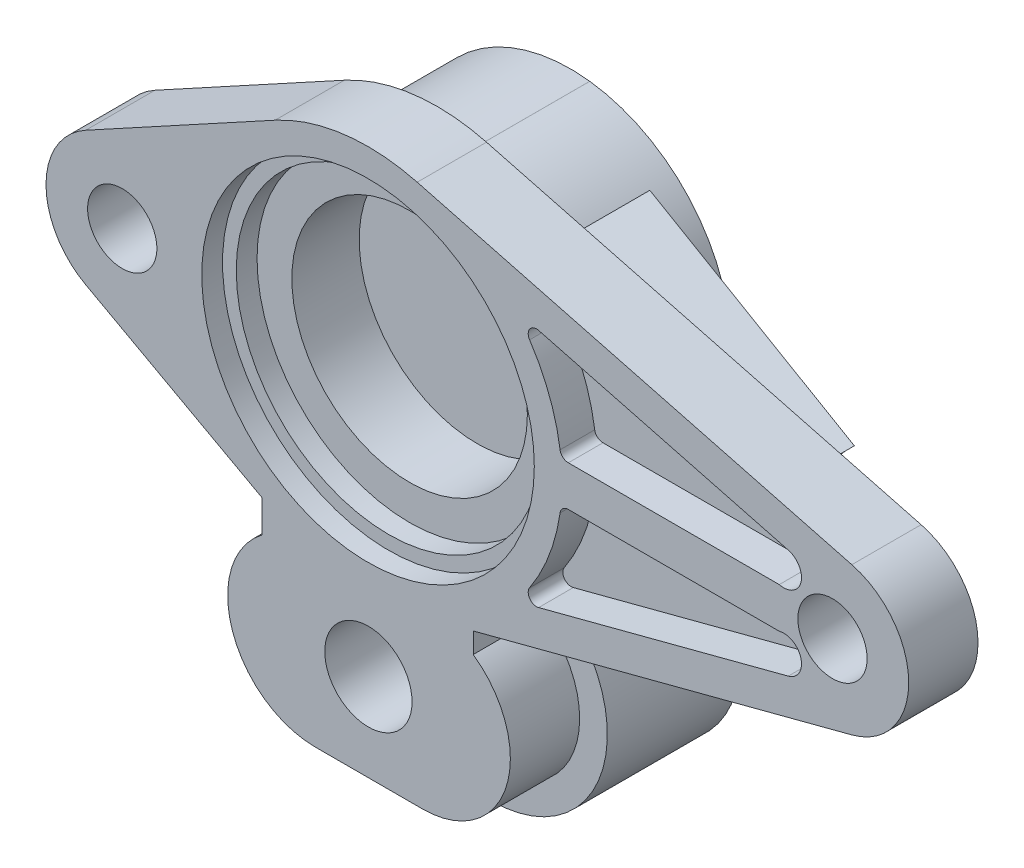
from build123d import *

# Parameters (mm, degrees)
BOSS_EXTRUDE1_DEPTH      = 6.35
BOSS_EXTRUDE2_DEPTH      = 12.192
BOSS_EXTRUDE3_REACH      = 63.797
CUT_EXTRUDE1_DEPTH       = 3.175
CUT_EXTRUDE2_DEPTH       = 3.175
F_8_0_8_DIAMETER_HOLE1_D = 8
HOLE1_D                  = 6.35
CHAMFER1_SIZE            = 3.256138018
CHAMFER2_SIZE            = 2.651435284
FILLET1_R                = 0.762
FILLET2_R                = 17.78


with BuildPart() as part:
    # Sketch1 → Boss-Extrude1 (new body)
    with BuildSketch(Plane.XY):
        with BuildLine():
            Line((-25.876615107, -6.130991244), (-6.855570788, -16.51429077))
            ThreePointArc((-6.855570788, -16.51429077), (-12.797339629, -25.300522195), (-4.835774214, -32.308799856))
            Line((-4.835774214, -32.308799856), (5.019425786, -32.308799856))
            ThreePointArc((5.019425786, -32.308799856), (12.97831912, -25.32120391), (7.079560008, -16.524890981))
            Line((7.079560008, -16.524890981), (44.341655967, -6.756691298))
            ThreePointArc((44.341655967, -6.756691298), (49.5554, 0), (44.341655967, 6.756691298))
            Line((44.341655967, 6.756691298), (-2.321508902, 18.989366367))
            Line((-2.321508902, 18.989366367), (-25.876615107, 6.130991244))
            ThreePointArc((-25.876615107, 6.130991244), (-29.5148, 0), (-25.876615107, -6.130991244))
        make_face()
    extrude(amount=-BOSS_EXTRUDE1_DEPTH)

    # Sketch2 → Boss-Extrude2 (add)
    with BuildSketch(Plane(origin=(0, 0, -6.35), x_dir=(-1, 0, 0), z_dir=(0, 0, -1))):
        with BuildLine():
            Line((4.835774214, -34.848799856), (-5.019425786, -34.848799856))
            ThreePointArc((-5.019425786, -34.848799856), (-14.222989868, -29.47308547), (-14.061825786, -18.815791108))
            Line((-14.061825786, -18.815791108), (-14.061825783, -4.219323287))
            ThreePointArc((-14.061825783, -4.219323287), (-12.289675842, 8.031282652), (-1.781242501, 14.572741966))
            Line((-1.781242501, 14.572741966), (-1.778349168, 14.573095333))
            ThreePointArc((-1.778349168, 14.573095333), (11.415932367, 9.231149524), (13.878174214, -4.788936617))
            Line((13.878174214, -4.788936617), (13.878174214, -18.815791108))
            ThreePointArc((13.878174214, -18.815791108), (14.039338296, -29.47308547), (4.835774214, -34.848799856))
        make_face()
    extrude(amount=BOSS_EXTRUDE2_DEPTH)

    # Boss-Extrude3: up to this plane
    boss_extrude3_end = Plane(origin=(5.084615624, 0, -17.49223415), z_dir=(0.2791253467698281, 0, -0.9602546749642114))
    # Sketch4 → Boss-Extrude3 (add, up to the surface)
    with BuildSketch(Plane(origin=(0, 0, -6.35), x_dir=(-1, 0, 0), z_dir=(0, 0, -1)), mode=Mode.PRIVATE) as boss_extrude3_sk1:
        with BuildLine():
            Line((-36.092721498, 7.827214142), (-9.663817118, 11.052070939))
            ThreePointArc((-9.663817118, 11.052070939), (-14.107813549, 4.062909083), (-14.061825786, -4.219323276))
            Line((-14.061825786, -4.219323276), (-14.061825786, -10.512648454))
            Line((-14.061825786, -10.512648454), (-36.084688558, -7.820559257))
            ThreePointArc((-36.084688558, -7.820559257), (-32.410401339, 0.005215736), (-36.092721498, 7.827214142))
        make_face()
    boss_extrude3_tool1 = split(extrude(boss_extrude3_sk1.sketch, amount=BOSS_EXTRUDE3_REACH, mode=Mode.PRIVATE), bisect_by=boss_extrude3_end, keep=Keep.BOTH, mode=Mode.PRIVATE)
    add(boss_extrude3_tool1.solids().sort_by_distance((23.208362, 0.258221, -6.35))[0])

    # Sketch5 → Cut-Extrude1 (cut)
    with BuildSketch(Plane.XY):
        with BuildLine():
            Line((17.683274588, 1.852079867), (37.689391665, 1.852079867))
            ThreePointArc((37.689391665, 1.852079867), (39.677118992, 3.014104647), (38.515094212, 5.001831974))
            Line((38.515094212, 5.001831974), (15.636334606, 10.999462718))
            ThreePointArc((15.636334606, 10.999462718), (14.82307645, 10.705321164), (14.808458463, 9.840627925))
            ThreePointArc((14.808458463, 9.840627925), (16.729686315, 6.020464751), (17.683274588, 1.852079867))
        make_face()
    extrude(amount=-CUT_EXTRUDE1_DEPTH, mode=Mode.SUBTRACT)

    # Sketch6 → Cut-Extrude2 (cut)
    with BuildSketch(Plane.XY):
        with BuildLine():
            Line((15.636334606, -10.999462718), (38.515094212, -5.001831974))
            ThreePointArc((38.515094212, -5.001831974), (39.677118992, -3.014104647), (37.689391665, -1.852079867))
            Line((37.689391665, -1.852079867), (17.683274588, -1.852079867))
            ThreePointArc((17.683274588, -1.852079867), (16.729686315, -6.020464751), (14.808458463, -9.840627925))
            ThreePointArc((14.808458463, -9.840627925), (14.82307645, -10.705321164), (15.636334606, -10.999462718))
        make_face()
    extrude(amount=-CUT_EXTRUDE2_DEPTH, mode=Mode.SUBTRACT)

    # Sketch7 → Cut-Revolve1 (revolve, cut)
    with BuildSketch(Plane(origin=(0, 0, 0), x_dir=(1, 0, 0), z_dir=(0, 1, 0))):
        Polygon((10.795, 9.9822), (0, 9.9822), (0, 0), (15.24, 0), (15.24, 1.905), (13.9827, 1.905), (13.9827, 3.81), (10.795, 3.81), align=None)
    revolve(axis=Axis((0, 0, -9.9822), (0, 0, 1)), mode=Mode.SUBTRACT)

    # Ø8.0 (8) Diameter Hole1 (through all)
    with Locations(Plane.XY):
        with Locations((0.034636225, -24.282399856)):
            Hole(F_8_0_8_DIAMETER_HOLE1_D / 2)

    # Hole1 (through all)
    with Locations(Plane(origin=(0, 0, -6.35), x_dir=(-1, 0, 0), z_dir=(0, 0, -1))):
        with Locations((-42.5704, 0), (22.5298, 0)):
            Hole(HOLE1_D / 2)

    # Chamfer1
    # the kernel refuses this chamfer: 3.256138018, 2.953062062 mm, written as the material it adds along each edge
    with BuildSketch(Plane(origin=(-6.855570788, -16.51429077, 0), x_dir=(-0.8777367565349716, 0.4791431792559171, 0), z_dir=(0, 0, -1))) as chamfer1_piece_1:
        with BuildLine():
            Line((CHAMFER1_SIZE, 0), (1.840697413, -2.592929003))
            ThreePointArc((1.840697413, -2.592929003), (1.066981917, -1.228355945), (0, 0))
            Line((0, 0), (CHAMFER1_SIZE, 0))
        make_face()
    extrude(amount=14.651282068)

    # Chamfer2
    # the kernel refuses this chamfer: 2.653671842, 2.651435284 mm, written as the material it adds along each edge
    with BuildSketch(Plane(origin=(7.079560008, -16.524890981, 0), x_dir=(0.9060971467141865, -0.4230696877778058, 0), z_dir=(0, 0, -1))) as chamfer2_piece_1:
        with BuildLine():
            Line((2.830570234, 0), (CHAMFER2_SIZE * 0.769198854398, -CHAMFER2_SIZE * 0.639009485396))
            Line((CHAMFER2_SIZE * 0.769198854398, -CHAMFER2_SIZE * 0.639009485396), (0, 0))
            ThreePointArc((0, 0), (1.438235904, -0.125730188), (2.830570234, 0))
        make_face()
    extrude(amount=13.542714548)

    # Fillet1
    fillet1_edges = [part.edges().sort_by_distance(p)[0] for p in [
        (17.683274588, 1.852079867, -1.5875),
        (17.683274588, -1.852079867, -1.5875),
    ]]
    fillet(fillet1_edges, radius=FILLET1_R)

    # Fillet2
    fillet2_edges = [part.edges().sort_by_distance(p)[0] for p in [
        (-2.321508902, 18.989366367, -3.175),
    ]]
    fillet(fillet2_edges, radius=FILLET2_R)


solid = part.part
